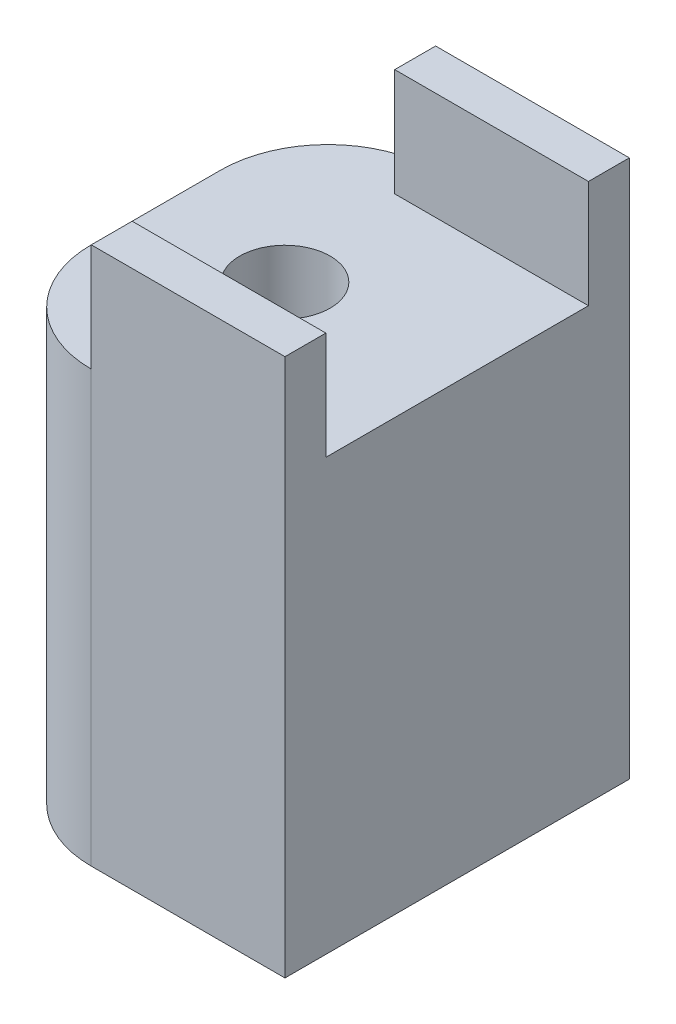
from build123d import *

# Parameters (mm, degrees)
SKETCH1_W           = 14
SKETCH1_H           = 16
SKETCH1_R           = 2.1
BOSS_EXTRUDE1_DEPTH = 20
FILLET1_R           = 5
SKETCH2_W           = 9
SKETCH2_H           = 1.9
BOSS_EXTRUDE2_DEPTH = 5


with BuildPart() as part:
    # Sketch1 → Boss-Extrude1 (new body)
    with BuildSketch(Plane(origin=(0, 0, 0), x_dir=(1, 0, 0), z_dir=(0, 1, 0))):
        with Locations((1, 0)):
            Rectangle(SKETCH1_W, SKETCH1_H)
        Circle(SKETCH1_R, mode=Mode.SUBTRACT)
    extrude(amount=BOSS_EXTRUDE1_DEPTH)

    # Fillet1
    fillet1_edges = [part.edges().sort_by_distance(p)[0] for p in [
        (-6, 10, -8),
        (-6, 10, 8),
    ]]
    fillet(fillet1_edges, radius=FILLET1_R)

    # Sketch2 → Boss-Extrude2 (add)
    with BuildSketch(Plane(origin=(0, 20, 0), x_dir=(1, 0, 0), z_dir=(0, 1, 0))):
        with Locations((3.5, 7.05)):
            Rectangle(SKETCH2_W, SKETCH2_H)
        with Locations((3.5, -7.05)):
            Rectangle(SKETCH2_W, SKETCH2_H)
    extrude(amount=BOSS_EXTRUDE2_DEPTH)


solid = part.part
